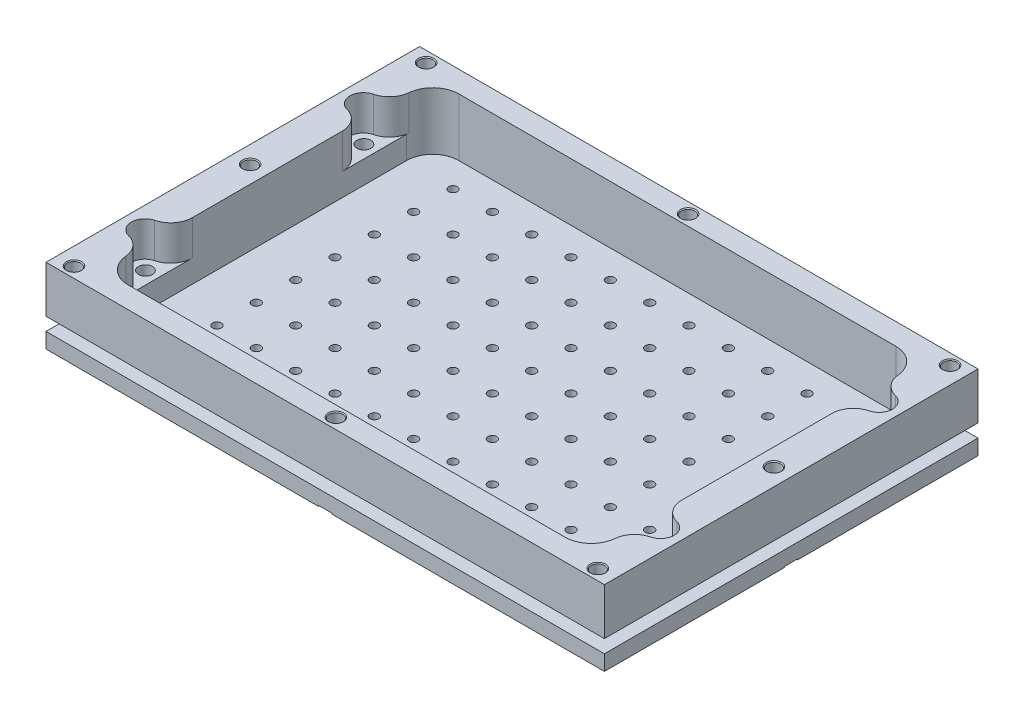
from build123d import *

# Parameters (mm, degrees)
ESQUISSE1_W                                      = 127.76
ESQUISSE1_H                                      = 85.48
BOSS_EXTRU_1_DEPTH                               = 12
ENL_V_MAT_EXTRU_1_DEPTH                          = 8
ESQUISSE3_W                                      = 141.76
ESQUISSE3_H                                      = 99.48
ESQUISSE3_W_2                                    = 121.76
ESQUISSE3_H_2                                    = 79.48
ENL_V_DE_MAT_EXTRU_MINCE1_DEPTH                  = 3
ESQUISSE5_R                                      = 1
ENL_V_MAT_EXTRU_2_DEPTH                          = 78.790500705
ENL_V_MAT_EXTRU_3_DEPTH                          = 2.8
ENL_V_MAT_EXTRU_4_DEPTH                          = 0.2
BOSS_EXTRU_2_START                               = 8
ESQUISSE16_W                                     = 127.76
ESQUISSE16_H                                     = 85.48
BOSS_EXTRU_2_DEPTH                               = 8
ENL_V_MAT_EXTRU_5_DEPTH                          = 8
FRAISAGE_POUR_VIS_T_TE_FRAIS_E_6_PAN_D           = 3.2
FRAISAGE_POUR_VIS_T_TE_FRAIS_E_6_PAN_CSINK_D     = 6.72
FRAISAGE_POUR_VIS_T_TE_FRAIS_E_6_PAN_CSINK_ANGLE = 90
CONG_1_R                                         = 5
ESQUISSE19_R                                     = 1.55
ENL_V_MAT_EXTRU_6_DEPTH                          = 3
CHANFREIN1_SIZE                                  = 0.2
ESQUISSE20_R                                     = 0.75
ENL_V_MAT_EXTRU_7_DEPTH                          = 2


with BuildPart() as part:
    # Esquisse1 → Boss.-Extru.1 (new body)
    with BuildSketch(Plane(origin=(0, 0, 0), x_dir=(1, 0, 0), z_dir=(0, 1, 0))):
        Rectangle(ESQUISSE1_W, ESQUISSE1_H)
    extrude(amount=BOSS_EXTRU_1_DEPTH)

    # Esquisse2 → Enlèv. mat.-Extru.1 (cut)
    with BuildSketch(Plane(origin=(0, 12, 0), x_dir=(1, 0, 0), z_dir=(0, 1, 0))):
        with BuildLine():
            Line((-49.98, 37.84), (49.98, 37.84))
            ThreePointArc((49.98, 37.84), (54.222640687, 36.082640687), (55.98, 31.84))
            Line((55.98, 31.84), (55.98, -31.84))
            ThreePointArc((55.98, -31.84), (54.222640687, -36.082640687), (49.98, -37.84))
            Line((49.98, -37.84), (-49.98, -37.84))
            ThreePointArc((-49.98, -37.84), (-54.222640687, -36.082640687), (-55.98, -31.84))
            Line((-55.98, -31.84), (-55.98, 31.84))
            ThreePointArc((-55.98, 31.84), (-54.222640687, 36.082640687), (-49.98, 37.84))
        make_face()
    extrude(amount=-ENL_V_MAT_EXTRU_1_DEPTH, mode=Mode.SUBTRACT)

    # Esquisse3 → Enlèv. de mat.-Extru.-Mince1 (cut)
    with BuildSketch(Plane(origin=(0, 3.5, 0), x_dir=(-1, 0, 0), z_dir=(0, -1, 0))):
        Rectangle(ESQUISSE3_W, ESQUISSE3_H)
        Rectangle(ESQUISSE3_W_2, ESQUISSE3_H_2, mode=Mode.SUBTRACT)
    extrude(amount=-ENL_V_DE_MAT_EXTRU_MINCE1_DEPTH, mode=Mode.SUBTRACT)

    # Esquisse5 → Enlèv. mat.-Extru.2 (cut, through all)
    with BuildSketch(Plane(origin=(0, 12, 0), x_dir=(1, 0, 0), z_dir=(0, 1, 0))):
        with Locations(Location((-45, 31.5, 0), (0, 0, 270))):
            Circle(ESQUISSE5_R)
        with Locations(Location((-36, 31.5, 0), (0, 0, 270))):
            Circle(ESQUISSE5_R)
        with Locations(Location((-27, 31.5, 0), (0, 0, 270))):
            Circle(ESQUISSE5_R)
        with Locations(Location((-18, 31.5, 0), (0, 0, 270))):
            Circle(ESQUISSE5_R)
        with Locations(Location((-9, 31.5, 0), (0, 0, 270))):
            Circle(ESQUISSE5_R)
        with Locations(Location((0, 31.5, 0), (0, 0, 270))):
            Circle(ESQUISSE5_R)
        with Locations(Location((9, 31.5, 0), (0, 0, 270))):
            Circle(ESQUISSE5_R)
        with Locations(Location((18, 31.5, 0), (0, 0, 270))):
            Circle(ESQUISSE5_R)
        with Locations(Location((27, 31.5, 0), (0, 0, 270))):
            Circle(ESQUISSE5_R)
        with Locations(Location((36, 31.5, 0), (0, 0, 270))):
            Circle(ESQUISSE5_R)
        with Locations(Location((45, 31.5, 0), (0, 0, 270))):
            Circle(ESQUISSE5_R)
        with Locations(Location((-36, 22.5, 0), (0, 0, 270))):
            Circle(ESQUISSE5_R)
        with Locations(Location((-27, 22.5, 0), (0, 0, 270))):
            Circle(ESQUISSE5_R)
        with Locations(Location((-18, 22.5, 0), (0, 0, 270))):
            Circle(ESQUISSE5_R)
        with Locations(Location((-9, 22.5, 0), (0, 0, 270))):
            Circle(ESQUISSE5_R)
        with Locations(Location((0, 22.5, 0), (0, 0, 270))):
            Circle(ESQUISSE5_R)
        with Locations(Location((9, 22.5, 0), (0, 0, 270))):
            Circle(ESQUISSE5_R)
        with Locations(Location((18, 22.5, 0), (0, 0, 270))):
            Circle(ESQUISSE5_R)
        with Locations(Location((27, 22.5, 0), (0, 0, 270))):
            Circle(ESQUISSE5_R)
        with Locations(Location((36, 22.5, 0), (0, 0, 270))):
            Circle(ESQUISSE5_R)
        with Locations(Location((45, 22.5, 0), (0, 0, 270))):
            Circle(ESQUISSE5_R)
        with Locations(Location((-36, 13.5, 0), (0, 0, 270))):
            Circle(ESQUISSE5_R)
        with Locations(Location((-27, 13.5, 0), (0, 0, 270))):
            Circle(ESQUISSE5_R)
        with Locations(Location((-18, 13.5, 0), (0, 0, 270))):
            Circle(ESQUISSE5_R)
        with Locations(Location((-9, 13.5, 0), (0, 0, 270))):
            Circle(ESQUISSE5_R)
        with Locations(Location((0, 13.5, 0), (0, 0, 270))):
            Circle(ESQUISSE5_R)
        with Locations(Location((9, 13.5, 0), (0, 0, 270))):
            Circle(ESQUISSE5_R)
        with Locations(Location((18, 13.5, 0), (0, 0, 270))):
            Circle(ESQUISSE5_R)
        with Locations(Location((27, 13.5, 0), (0, 0, 270))):
            Circle(ESQUISSE5_R)
        with Locations(Location((36, 13.5, 0), (0, 0, 270))):
            Circle(ESQUISSE5_R)
        with Locations(Location((45, 13.5, 0), (0, 0, 270))):
            Circle(ESQUISSE5_R)
        with Locations(Location((-36, 4.5, 0), (0, 0, 270))):
            Circle(ESQUISSE5_R)
        with Locations(Location((-27, 4.5, 0), (0, 0, 270))):
            Circle(ESQUISSE5_R)
        with Locations(Location((-18, 4.5, 0), (0, 0, 270))):
            Circle(ESQUISSE5_R)
        with Locations(Location((-9, 4.5, 0), (0, 0, 270))):
            Circle(ESQUISSE5_R)
        with Locations(Location((0, 4.5, 0), (0, 0, 270))):
            Circle(ESQUISSE5_R)
        with Locations(Location((9, 4.5, 0), (0, 0, 270))):
            Circle(ESQUISSE5_R)
        with Locations(Location((18, 4.5, 0), (0, 0, 270))):
            Circle(ESQUISSE5_R)
        with Locations(Location((27, 4.5, 0), (0, 0, 270))):
            Circle(ESQUISSE5_R)
        with Locations(Location((36, 4.5, 0), (0, 0, 270))):
            Circle(ESQUISSE5_R)
        with Locations(Location((45, 4.5, 0), (0, 0, 270))):
            Circle(ESQUISSE5_R)
        with Locations(Location((-36, -4.5, 0), (0, 0, 270))):
            Circle(ESQUISSE5_R)
        with Locations(Location((-27, -4.5, 0), (0, 0, 270))):
            Circle(ESQUISSE5_R)
        with Locations(Location((-18, -4.5, 0), (0, 0, 270))):
            Circle(ESQUISSE5_R)
        with Locations(Location((-9, -4.5, 0), (0, 0, 270))):
            Circle(ESQUISSE5_R)
        with Locations(Location((0, -4.5, 0), (0, 0, 270))):
            Circle(ESQUISSE5_R)
        with Locations(Location((9, -4.5, 0), (0, 0, 270))):
            Circle(ESQUISSE5_R)
        with Locations(Location((18, -4.5, 0), (0, 0, 270))):
            Circle(ESQUISSE5_R)
        with Locations(Location((27, -4.5, 0), (0, 0, 270))):
            Circle(ESQUISSE5_R)
        with Locations(Location((36, -4.5, 0), (0, 0, 270))):
            Circle(ESQUISSE5_R)
        with Locations(Location((45, -4.5, 0), (0, 0, 270))):
            Circle(ESQUISSE5_R)
        with Locations(Location((-36, -13.5, 0), (0, 0, 270))):
            Circle(ESQUISSE5_R)
        with Locations(Location((-27, -13.5, 0), (0, 0, 270))):
            Circle(ESQUISSE5_R)
        with Locations(Location((-18, -13.5, 0), (0, 0, 270))):
            Circle(ESQUISSE5_R)
        with Locations(Location((-9, -13.5, 0), (0, 0, 270))):
            Circle(ESQUISSE5_R)
        with Locations(Location((0, -13.5, 0), (0, 0, 270))):
            Circle(ESQUISSE5_R)
        with Locations(Location((9, -13.5, 0), (0, 0, 270))):
            Circle(ESQUISSE5_R)
        with Locations(Location((18, -13.5, 0), (0, 0, 270))):
            Circle(ESQUISSE5_R)
        with Locations(Location((27, -13.5, 0), (0, 0, 270))):
            Circle(ESQUISSE5_R)
        with Locations(Location((36, -13.5, 0), (0, 0, 270))):
            Circle(ESQUISSE5_R)
        with Locations(Location((45, -13.5, 0), (0, 0, 270))):
            Circle(ESQUISSE5_R)
        with Locations(Location((-36, -22.5, 0), (0, 0, 270))):
            Circle(ESQUISSE5_R)
        with Locations(Location((-27, -22.5, 0), (0, 0, 270))):
            Circle(ESQUISSE5_R)
        with Locations(Location((-18, -22.5, 0), (0, 0, 270))):
            Circle(ESQUISSE5_R)
        with Locations(Location((-9, -22.5, 0), (0, 0, 270))):
            Circle(ESQUISSE5_R)
        with Locations(Location((0, -22.5, 0), (0, 0, 270))):
            Circle(ESQUISSE5_R)
        with Locations(Location((9, -22.5, 0), (0, 0, 270))):
            Circle(ESQUISSE5_R)
        with Locations(Location((18, -22.5, 0), (0, 0, 270))):
            Circle(ESQUISSE5_R)
        with Locations(Location((27, -22.5, 0), (0, 0, 270))):
            Circle(ESQUISSE5_R)
        with Locations(Location((36, -22.5, 0), (0, 0, 270))):
            Circle(ESQUISSE5_R)
        with Locations(Location((45, -22.5, 0), (0, 0, 270))):
            Circle(ESQUISSE5_R)
        with Locations(Location((-36, -31.5, 0), (0, 0, 270))):
            Circle(ESQUISSE5_R)
        with Locations(Location((-27, -31.5, 0), (0, 0, 270))):
            Circle(ESQUISSE5_R)
        with Locations(Location((-18, -31.5, 0), (0, 0, 270))):
            Circle(ESQUISSE5_R)
        with Locations(Location((-9, -31.5, 0), (0, 0, 270))):
            Circle(ESQUISSE5_R)
        with Locations(Location((0, -31.5, 0), (0, 0, 270))):
            Circle(ESQUISSE5_R)
        with Locations(Location((9, -31.5, 0), (0, 0, 270))):
            Circle(ESQUISSE5_R)
        with Locations(Location((18, -31.5, 0), (0, 0, 270))):
            Circle(ESQUISSE5_R)
        with Locations(Location((27, -31.5, 0), (0, 0, 270))):
            Circle(ESQUISSE5_R)
        with Locations(Location((36, -31.5, 0), (0, 0, 270))):
            Circle(ESQUISSE5_R)
        with Locations(Location((45, -31.5, 0), (0, 0, 270))):
            Circle(ESQUISSE5_R)
        with Locations(Location((-45, 22.5, 0), (0, 0, 270))):
            Circle(ESQUISSE5_R)
        with Locations(Location((-45, 13.5, 0), (0, 0, 270))):
            Circle(ESQUISSE5_R)
        with Locations(Location((-45, 4.5, 0), (0, 0, 270))):
            Circle(ESQUISSE5_R)
        with Locations(Location((-45, -4.5, 0), (0, 0, 270))):
            Circle(ESQUISSE5_R)
        with Locations(Location((-45, -13.5, 0), (0, 0, 270))):
            Circle(ESQUISSE5_R)
        with Locations(Location((-45, -22.5, 0), (0, 0, 270))):
            Circle(ESQUISSE5_R)
        with Locations(Location((-45, -31.5, 0), (0, 0, 270))):
            Circle(ESQUISSE5_R)
    extrude(amount=-ENL_V_MAT_EXTRU_2_DEPTH, mode=Mode.SUBTRACT)

    # Esquisse6 → Enlèv. mat.-Extru.3 (cut)
    with BuildSketch(Plane(origin=(0, 12, 0), x_dir=(1, 0, 0), z_dir=(0, 1, 0))):
        with BuildLine():
            Line((-55.88, 37.84), (55.88, 37.84))
            ThreePointArc((55.88, 37.84), (60.122640687, 36.082640687), (61.88, 31.84))
            Line((61.88, 31.84), (61.88, -31.84))
            ThreePointArc((61.88, -31.84), (60.122640687, -36.082640687), (55.88, -37.84))
            Line((55.88, -37.84), (-55.88, -37.84))
            ThreePointArc((-55.88, -37.84), (-60.122640687, -36.082640687), (-61.88, -31.84))
            Line((-61.88, -31.84), (-61.88, 31.84))
            ThreePointArc((-61.88, 31.84), (-60.122640687, 36.082640687), (-55.88, 37.84))
        make_face()
    extrude(amount=-ENL_V_MAT_EXTRU_3_DEPTH, mode=Mode.SUBTRACT)

    # Esquisse15 → Enlèv. mat.-Extru.4 (cut)
    with BuildSketch(Plane(origin=(0, 0, 0), x_dir=(-1, 0, 0), z_dir=(0, -1, 0))):
        with BuildLine():
            Line((45, -33), (1.5, -33))
            Line((1.5, -33), (1.5, -42.74))
            Line((1.5, -42.74), (-1.5, -42.74))
            Line((-1.5, -42.74), (-1.5, -33))
            Line((-1.5, -33), (-45, -33))
            ThreePointArc((-45, -33), (-46.060660172, -32.560660172), (-46.5, -31.5))
            Line((-46.5, -31.5), (-46.5, -1.5))
            Line((-46.5, -1.5), (-63.88, -1.5))
            Line((-63.88, -1.5), (-63.88, 1.5))
            Line((-63.88, 1.5), (-46.5, 1.5))
            Line((-46.5, 1.5), (-46.5, 31.5))
            ThreePointArc((-46.5, 31.5), (-46.060660172, 32.560660172), (-45, 33))
            Line((-45, 33), (-1.5, 33))
            Line((-1.5, 33), (-1.5, 42.74))
            Line((-1.5, 42.74), (1.5, 42.74))
            Line((1.5, 42.74), (1.5, 33))
            Line((1.5, 33), (45, 33))
            ThreePointArc((45, 33), (46.060660172, 32.560660172), (46.5, 31.5))
            Line((46.5, 31.5), (46.5, 1.5))
            Line((46.5, 1.5), (63.88, 1.5))
            Line((63.88, 1.5), (63.88, -1.5))
            Line((63.88, -1.5), (46.5, -1.5))
            Line((46.5, -1.5), (46.5, -31.5))
            ThreePointArc((46.5, -31.5), (46.060660172, -32.560660172), (45, -33))
        make_face()
        with BuildLine():
            Line((36, 24), (1.5, 24))
            Line((1.5, 24), (1.5, 30))
            Line((1.5, 30), (43.5, 30))
            Line((43.5, 30), (43.5, 1.5))
            Line((43.5, 1.5), (37.5, 1.5))
            Line((37.5, 1.5), (37.5, 22.5))
            ThreePointArc((37.5, 22.5), (37.060660172, 23.560660172), (36, 24))
        make_face(mode=Mode.SUBTRACT)
        with BuildLine():
            Line((43.5, -30), (1.5, -30))
            Line((1.5, -30), (1.5, -24))
            Line((1.5, -24), (36, -24))
            ThreePointArc((36, -24), (37.060660172, -23.560660172), (37.5, -22.5))
            Line((37.5, -22.5), (37.5, -1.5))
            Line((37.5, -1.5), (43.5, -1.5))
            Line((43.5, -1.5), (43.5, -30))
        make_face(mode=Mode.SUBTRACT)
        with BuildLine():
            Line((-43.5, -30), (-43.5, -1.5))
            Line((-43.5, -1.5), (-37.5, -1.5))
            Line((-37.5, -1.5), (-37.5, -22.5))
            ThreePointArc((-37.5, -22.5), (-37.060660172, -23.560660172), (-36, -24))
            Line((-36, -24), (-1.5, -24))
            Line((-1.5, -24), (-1.5, -30))
            Line((-1.5, -30), (-43.5, -30))
        make_face(mode=Mode.SUBTRACT)
        with BuildLine():
            Line((34.5, 21), (1.5, 21))
            Line((1.5, 21), (1.5, 15))
            Line((1.5, 15), (27, 15))
            ThreePointArc((27, 15), (28.060660172, 14.560660172), (28.5, 13.5))
            Line((28.5, 13.5), (28.5, 1.5))
            Line((28.5, 1.5), (34.5, 1.5))
            Line((34.5, 1.5), (34.5, 21))
        make_face(mode=Mode.SUBTRACT)
        with BuildLine():
            Line((-34.5, -21), (-34.5, -1.5))
            Line((-34.5, -1.5), (-28.5, -1.5))
            Line((-28.5, -1.5), (-28.5, -13.5))
            ThreePointArc((-28.5, -13.5), (-28.060660172, -14.560660172), (-27, -15))
            Line((-27, -15), (-1.5, -15))
            Line((-1.5, -15), (-1.5, -21))
            Line((-1.5, -21), (-34.5, -21))
        make_face(mode=Mode.SUBTRACT)
        with BuildLine():
            Line((34.5, -21), (1.5, -21))
            Line((1.5, -21), (1.5, -15))
            Line((1.5, -15), (27, -15))
            ThreePointArc((27, -15), (28.060660172, -14.560660172), (28.5, -13.5))
            Line((28.5, -13.5), (28.5, -1.5))
            Line((28.5, -1.5), (34.5, -1.5))
            Line((34.5, -1.5), (34.5, -21))
        make_face(mode=Mode.SUBTRACT)
        with BuildLine():
            Line((-25.5, -12), (-25.5, -1.5))
            Line((-25.5, -1.5), (-19.5, -1.5))
            Line((-19.5, -1.5), (-19.5, -4.5))
            ThreePointArc((-19.5, -4.5), (-19.060660172, -5.560660172), (-18, -6))
            Line((-18, -6), (-1.5, -6))
            Line((-1.5, -6), (-1.5, -12))
            Line((-1.5, -12), (-25.5, -12))
        make_face(mode=Mode.SUBTRACT)
        with BuildLine():
            Line((25.5, 12), (1.5, 12))
            Line((1.5, 12), (1.5, 6))
            Line((1.5, 6), (18, 6))
            ThreePointArc((18, 6), (19.060660172, 5.560660172), (19.5, 4.5))
            Line((19.5, 4.5), (19.5, 1.5))
            Line((19.5, 1.5), (25.5, 1.5))
            Line((25.5, 1.5), (25.5, 12))
        make_face(mode=Mode.SUBTRACT)
        with BuildLine():
            Line((25.5, -12), (25.5, -1.5))
            Line((25.5, -1.5), (19.5, -1.5))
            Line((19.5, -1.5), (19.5, -4.5))
            ThreePointArc((19.5, -4.5), (19.060660172, -5.560660172), (18, -6))
            Line((18, -6), (1.5, -6))
            Line((1.5, -6), (1.5, -12))
            Line((1.5, -12), (25.5, -12))
        make_face(mode=Mode.SUBTRACT)
        with BuildLine():
            Line((-1.5, 30), (-1.5, 24))
            Line((-1.5, 24), (-36, 24))
            ThreePointArc((-36, 24), (-37.060660172, 23.560660172), (-37.5, 22.5))
            Line((-37.5, 22.5), (-37.5, 1.5))
            Line((-37.5, 1.5), (-43.5, 1.5))
            Line((-43.5, 1.5), (-43.5, 30))
            Line((-43.5, 30), (-1.5, 30))
        make_face(mode=Mode.SUBTRACT)
        with BuildLine():
            Line((-1.5, 21), (-1.5, 15))
            Line((-1.5, 15), (-27, 15))
            ThreePointArc((-27, 15), (-28.060660172, 14.560660172), (-28.5, 13.5))
            Line((-28.5, 13.5), (-28.5, 1.5))
            Line((-28.5, 1.5), (-34.5, 1.5))
            Line((-34.5, 1.5), (-34.5, 21))
            Line((-34.5, 21), (-1.5, 21))
        make_face(mode=Mode.SUBTRACT)
        with BuildLine():
            Line((-1.5, 12), (-25.5, 12))
            Line((-25.5, 12), (-25.5, 1.5))
            Line((-25.5, 1.5), (-19.5, 1.5))
            Line((-19.5, 1.5), (-19.5, 4.5))
            ThreePointArc((-19.5, 4.5), (-19.060660172, 5.560660172), (-18, 6))
            Line((-18, 6), (-1.5, 6))
            Line((-1.5, 6), (-1.5, 12))
        make_face(mode=Mode.SUBTRACT)
    extrude(amount=-ENL_V_MAT_EXTRU_4_DEPTH, mode=Mode.SUBTRACT)

    # Esquisse16 → Boss.-Extru.2 (add)
    with BuildSketch(Plane(origin=(0, 9.2, 0), x_dir=(1, 0, 0), z_dir=(0, 1, 0)).offset(BOSS_EXTRU_2_START)):
        Rectangle(ESQUISSE16_W, ESQUISSE16_H)
        with BuildLine():
            Line((-55.98, 31.84), (-55.98, -31.84))
            ThreePointArc((-55.98, -31.84), (-54.222640687, -36.082640687), (-49.98, -37.84))
            Line((-49.98, -37.84), (49.98, -37.84))
            ThreePointArc((49.98, -37.84), (54.222640687, -36.082640687), (55.98, -31.84))
            Line((55.98, -31.84), (55.98, 31.84))
            ThreePointArc((55.98, 31.84), (54.222640687, 36.082640687), (49.98, 37.84))
            Line((49.98, 37.84), (-49.98, 37.84))
            ThreePointArc((-49.98, 37.84), (-54.222640687, 36.082640687), (-55.98, 31.84))
        make_face(mode=Mode.SUBTRACT)
    extrude(amount=-BOSS_EXTRU_2_DEPTH)

    # Esquisse18 → Enlèv. mat.-Extru.5 (cut)
    with BuildSketch(Plane(origin=(0, 17.2, 0), x_dir=(1, 0, 0), z_dir=(0, 1, 0))):
        with BuildLine():
            Line((55.98, -21.9), (58.98, -21.9))
            ThreePointArc((58.98, -21.9), (62.08, -25), (58.98, -28.1))
            Line((58.98, -28.1), (55.98, -28.1))
            Line((55.98, -28.1), (55.98, -21.9))
        make_face()
        with BuildLine():
            Line((-55.98, -28.1), (-55.98, -21.9))
            Line((-55.98, -21.9), (-58.98, -21.9))
            ThreePointArc((-58.98, -21.9), (-62.08, -25), (-58.98, -28.1))
            Line((-58.98, -28.1), (-55.98, -28.1))
        make_face()
        with BuildLine():
            Line((-55.98, 21.9), (-58.98, 21.9))
            ThreePointArc((-58.98, 21.9), (-62.08, 25), (-58.98, 28.1))
            Line((-58.98, 28.1), (-55.98, 28.1))
            Line((-55.98, 28.1), (-55.98, 21.9))
        make_face()
        with BuildLine():
            Line((55.98, 28.1), (55.98, 21.9))
            Line((55.98, 21.9), (58.98, 21.9))
            ThreePointArc((58.98, 21.9), (62.08, 25), (58.98, 28.1))
            Line((58.98, 28.1), (55.98, 28.1))
        make_face()
    extrude(amount=-ENL_V_MAT_EXTRU_5_DEPTH, mode=Mode.SUBTRACT)

    # Fraisage pour vis à tête fraisée à 6 pans creux M31 (through all)
    with Locations(Plane(origin=(0, 0, 0), x_dir=(-1, 0, 0), z_dir=(0, -1, 0))):
        with Locations((-58.88, 25), (-58.88, -25), (58.88, -25), (58.88, 25)):
            CounterSinkHole(FRAISAGE_POUR_VIS_T_TE_FRAIS_E_6_PAN_D / 2, FRAISAGE_POUR_VIS_T_TE_FRAIS_E_6_PAN_CSINK_D / 2, counter_sink_angle=FRAISAGE_POUR_VIS_T_TE_FRAIS_E_6_PAN_CSINK_ANGLE)

    # Congé1
    # the kernel refuses this fillet: 5 mm, written as the material it takes off along each edge
    with BuildSketch(Plane(origin=(55.98, 27.942678329, 28.1), x_dir=(-0.006029547408973276, 0, 0.9999818221138037), z_dir=(0, -1, 0))) as cong_1_piece_1:
        with BuildLine():
            CenterArc((4.731206359, -4.981117021), CONG_1_R, 94.981093062, 70.724957247)
            Line((-0.114002684, -3.746633594), (-0.598523589, -3.623185251))
            ThreePointArc((-0.598523589, -3.623185251), (-0.518079553, -2.996930693), (-0.499990911, 0.003014774))
            Line((-0.499990911, 0.003014774), (0.003014774, 0.499990911))
            ThreePointArc((0.003014774, 0.499990911), (3.742946788, 0.477440404), (4.253657829, 0.498111702))
            Line((4.253657829, 0.498111702), (4.297071332, 0))
        make_face()
    extrude(amount=18.742678329, mode=Mode.SUBTRACT)
    with BuildSketch(Plane(origin=(55.98, 29.073009453, 21.9), x_dir=(0.999675268739471, 0, 0.025482485566887397), z_dir=(0, -1, 0)), Plane(origin=(-55.98, 29.073009453, -21.9), x_dir=(-0.9996752687394712, 0, -0.025482485566874102), z_dir=(0, -1, 0))) as cong_1_piece_2:
        with BuildLine():
            CenterArc((4.877354827, -4.875073994), CONG_1_R, 102.834751686, 75.705051379)
            Line((-0.121021517, -4.747661566), (-0.620859151, -4.734920324))
            Line((-0.620859151, -4.734920324), (-0.499837634, 0.012741243))
            Line((-0.499837634, 0.012741243), (0.012741243, 0.499837634))
            ThreePointArc((0.012741243, 0.499837634), (3.011767049, 0.423390178), (3.655585292, 0.487507399))
            Line((3.655585292, 0.487507399), (3.766655249, 0))
        make_face()
    extrude(amount=19.873009453, mode=Mode.SUBTRACT)
    with BuildSketch(Plane(origin=(55.98, 29.073009453, -21.9), x_dir=(0.9996752687394714, 0, -0.025482485566868496), z_dir=(0, -1, 0)), Plane(origin=(-55.98, 29.073009453, 21.9), x_dir=(-0.9996752687394711, 0, 0.025482485566881645), z_dir=(0, -1, 0))) as cong_1_piece_3:
        with BuildLine():
            CenterArc((4.877354827, 4.875073994), CONG_1_R, 181.460196935, 75.705051379)
            Line((-0.121021517, 4.747661566), (-0.620859151, 4.734920324))
            Line((-0.620859151, 4.734920324), (-0.499837634, -0.012741243))
            Line((-0.499837634, -0.012741243), (0.012741243, -0.499837634))
            ThreePointArc((0.012741243, -0.499837634), (3.011767049, -0.423390178), (3.655585292, -0.487507399))
            Line((3.655585292, -0.487507399), (3.766655249, 0))
        make_face()
    extrude(amount=19.873009453, mode=Mode.SUBTRACT)
    with BuildSketch(Plane(origin=(55.98, 27.942678329, -28.1), x_dir=(0.9997026015741162, 0, 0.02438664400740667), z_dir=(0, -1, 0)), Plane(origin=(-55.98, 27.942678329, 28.1), x_dir=(-0.9997026015741165, 0, -0.024386644007392416), z_dir=(0, -1, 0))) as cong_1_piece_4:
        with BuildLine():
            CenterArc((4.834918003, -4.880513118), CONG_1_R, 102.551089671, 70.724957247)
            Line((-0.130690934, -4.295083458), (-0.627251828, -4.236540492))
            ThreePointArc((-0.627251828, -4.236540492), (-0.591057349, -3.726694408), (-0.499851301, 0.012193322))
            Line((-0.499851301, 0.012193322), (0.012193322, 0.499851301))
            ThreePointArc((0.012193322, 0.499851301), (3.011301127, 0.426691369), (3.639712594, 0.488051312))
            Line((3.639712594, 0.488051312), (3.748367631, 0))
        make_face()
    extrude(amount=18.742678329, mode=Mode.SUBTRACT)
    with BuildSketch(Plane(origin=(-55.98, 27.942678329, -28.1), x_dir=(-0.9997026015741164, 0, 0.024386644007399), z_dir=(0, -1, 0))) as cong_1_piece_5:
        with BuildLine():
            CenterArc((4.834918003, 4.880513118), CONG_1_R, 186.723953083, 70.724957247)
            Line((-0.130690934, 4.295083458), (-0.627251828, 4.236540492))
            ThreePointArc((-0.627251828, 4.236540492), (-0.591057349, 3.726694408), (-0.499851301, -0.012193322))
            Line((-0.499851301, -0.012193322), (0.012193322, -0.499851301))
            ThreePointArc((0.012193322, -0.499851301), (3.011301127, -0.426691369), (3.639712594, -0.488051312))
            Line((3.639712594, -0.488051312), (3.748367631, 0))
        make_face()
    extrude(amount=18.742678329, mode=Mode.SUBTRACT)

    # Esquisse19 → Enlèv. mat.-Extru.6 (cut)
    with BuildSketch(Plane(origin=(0, 17.2, 0), x_dir=(1, 0, 0), z_dir=(0, 1, 0))):
        with Locations(Location((-59.93, 40.29, 0), (0, 0, 270))):
            Circle(ESQUISSE19_R)
        with Locations(Location((0, 40.29, 0), (0, 0, 270))):
            Circle(ESQUISSE19_R)
        with Locations(Location((-59.93, 0, 0), (0, 0, 270))):
            Circle(ESQUISSE19_R)
        with Locations(Location((59.93, 0, 0), (0, 0, 90))):
            Circle(ESQUISSE19_R)
        with Locations(Location((59.93, 40.29, 0), (0, 0, 90))):
            Circle(ESQUISSE19_R)
        with Locations(Location((59.93, -40.29, 0), (0, 0, 270))):
            Circle(ESQUISSE19_R)
        with Locations(Location((0, -40.29, 0), (0, 0, 90))):
            Circle(ESQUISSE19_R)
        with Locations(Location((-59.93, -40.29, 0), (0, 0, 90))):
            Circle(ESQUISSE19_R)
    extrude(amount=-ENL_V_MAT_EXTRU_6_DEPTH, mode=Mode.SUBTRACT)

    # Chanfrein1
    chanfrein1_edges = [part.edges().sort_by_distance(p)[0] for p in [
        (-59.93, 17.2, 41.84),
        (0, 17.2, 41.84),
        (59.93, 17.2, 38.74),
        (59.93, 17.2, -38.74),
        (59.93, 17.2, 1.55),
        (-59.93, 17.2, -1.55),
        (0, 17.2, -41.84),
        (-59.93, 17.2, -41.84),
    ]]
    chamfer(chanfrein1_edges, length=CHANFREIN1_SIZE)

    # Esquisse20 → Enlèv. mat.-Extru.7 (cut)
    with BuildSketch(Plane(origin=(0, 14.2, 0), x_dir=(1, 0, 0), z_dir=(0, 1, 0))):
        with Locations(Location((59.93, 40.29, 0), (0, 0, 270))):
            Circle(ESQUISSE20_R)
        with Locations(Location((0, 40.29, 0), (0, 0, 270))):
            Circle(ESQUISSE20_R)
        with Locations(Location((-59.93, 40.29, 0), (0, 0, 270))):
            Circle(ESQUISSE20_R)
        with Locations(Location((-59.93, 0, 0), (0, 0, 270))):
            Circle(ESQUISSE20_R)
        with Locations(Location((-59.93, -40.29, 0), (0, 0, 270))):
            Circle(ESQUISSE20_R)
        with Locations(Location((0, -40.29, 0), (0, 0, 270))):
            Circle(ESQUISSE20_R)
        with Locations(Location((59.93, -40.29, 0), (0, 0, 270))):
            Circle(ESQUISSE20_R)
        with Locations(Location((59.93, 0, 0), (0, 0, 270))):
            Circle(ESQUISSE20_R)
    extrude(amount=-ENL_V_MAT_EXTRU_7_DEPTH, mode=Mode.SUBTRACT)


solid = part.part
